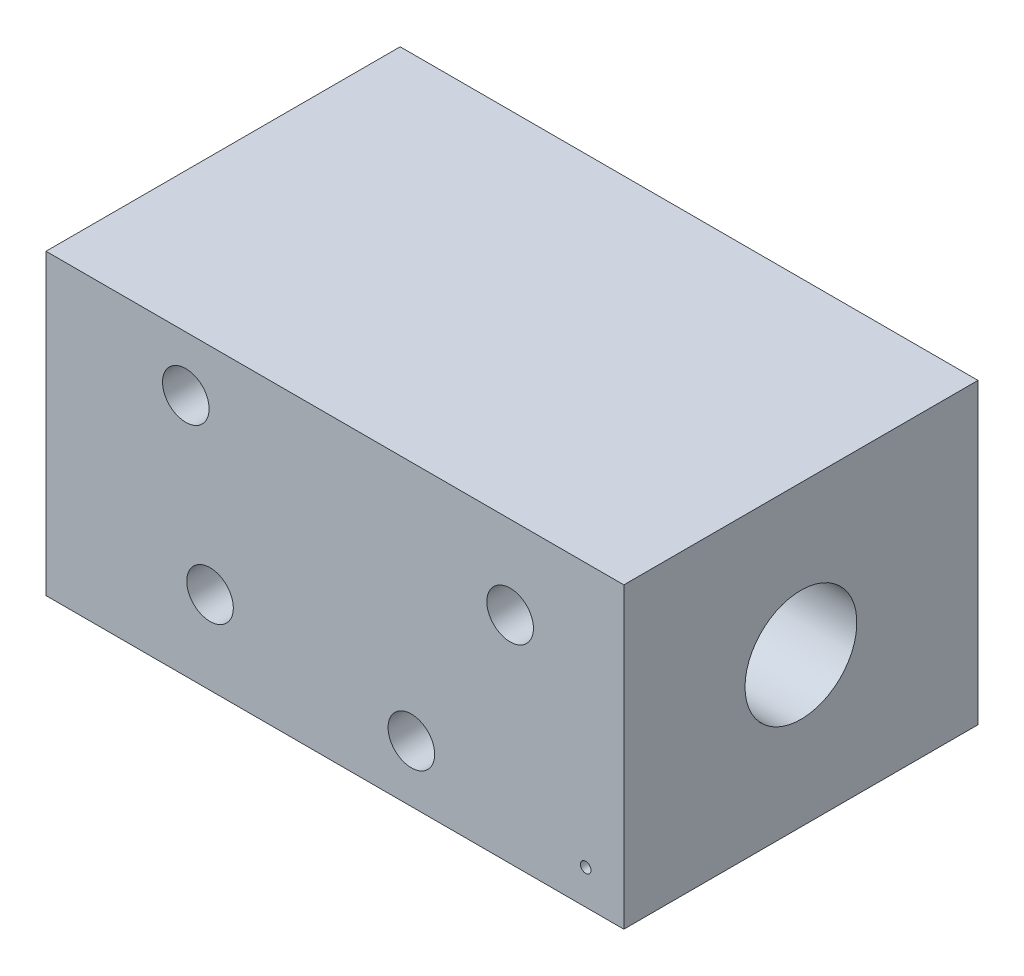
from build123d import *

# Parameters (mm, degrees)
SKETCH1_W           = 31
SKETCH1_H           = 19
BOSS_EXTRUDE1_DEPTH = 16
SKETCH3_R           = 0.281444084
SKETCH3_R_2         = 1.25
CUT_EXTRUDE1_DEPTH  = 2
SKETCH7_R           = 3
CUT_EXTRUDE2_DEPTH  = 37.15591238


with BuildPart() as part:
    # Sketch1 → Boss-Extrude1 (new body)
    with BuildSketch(Plane(origin=(0, 0, 0), x_dir=(1, 0, 0), z_dir=(0, 1, 0))):
        Rectangle(SKETCH1_W, SKETCH1_H)
    extrude(amount=BOSS_EXTRUDE1_DEPTH)

    # Sketch3 → Cut-Extrude1 (cut)
    with BuildSketch(Plane.XY.offset(9.5)):
        with Locations((13.453106284, 1.855552565)):
            Circle(SKETCH3_R)
        with Locations((9.4, 11.55)):
            Circle(SKETCH3_R_2)
        with Locations((4.1, 3.05)):
            Circle(SKETCH3_R_2)
        with Locations((-6.7, 4.45)):
            Circle(SKETCH3_R_2)
        with Locations((-8, 13.05)):
            Circle(SKETCH3_R_2)
    extrude(amount=-CUT_EXTRUDE1_DEPTH, mode=Mode.SUBTRACT)

    # Sketch7 → Cut-Extrude2 (cut, through all)
    with BuildSketch(Plane.ZY.offset(15.5)):
        with Locations((0, 8)):
            Circle(SKETCH7_R)
    extrude(amount=-CUT_EXTRUDE2_DEPTH, mode=Mode.SUBTRACT)


solid = part.part
